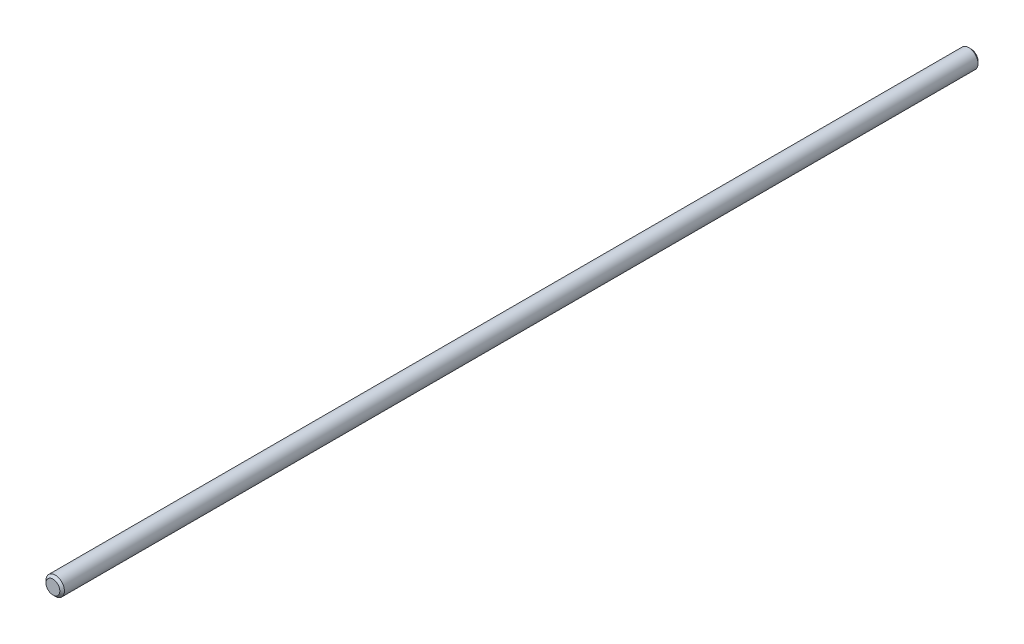
from build123d import *

# Parameters (mm, degrees)
SCHIZZO1_R                   = 4
ESTRUSIONE_ESTRUSIONE1_DEPTH = 398
SMUSSO1_SIZE                 = 1


with BuildPart() as part:
    # Schizzo1 → Estrusione-Estrusione1 (new body)
    with BuildSketch(Plane.XY):
        Circle(SCHIZZO1_R)
    extrude(amount=ESTRUSIONE_ESTRUSIONE1_DEPTH)

    # Smusso1
    smusso1_edges = [part.edges().sort_by_distance(p)[0] for p in [
        (-4, 0, 398),
        (-4, 0, 0),
    ]]
    chamfer(smusso1_edges, length=SMUSSO1_SIZE)


solid = part.part
